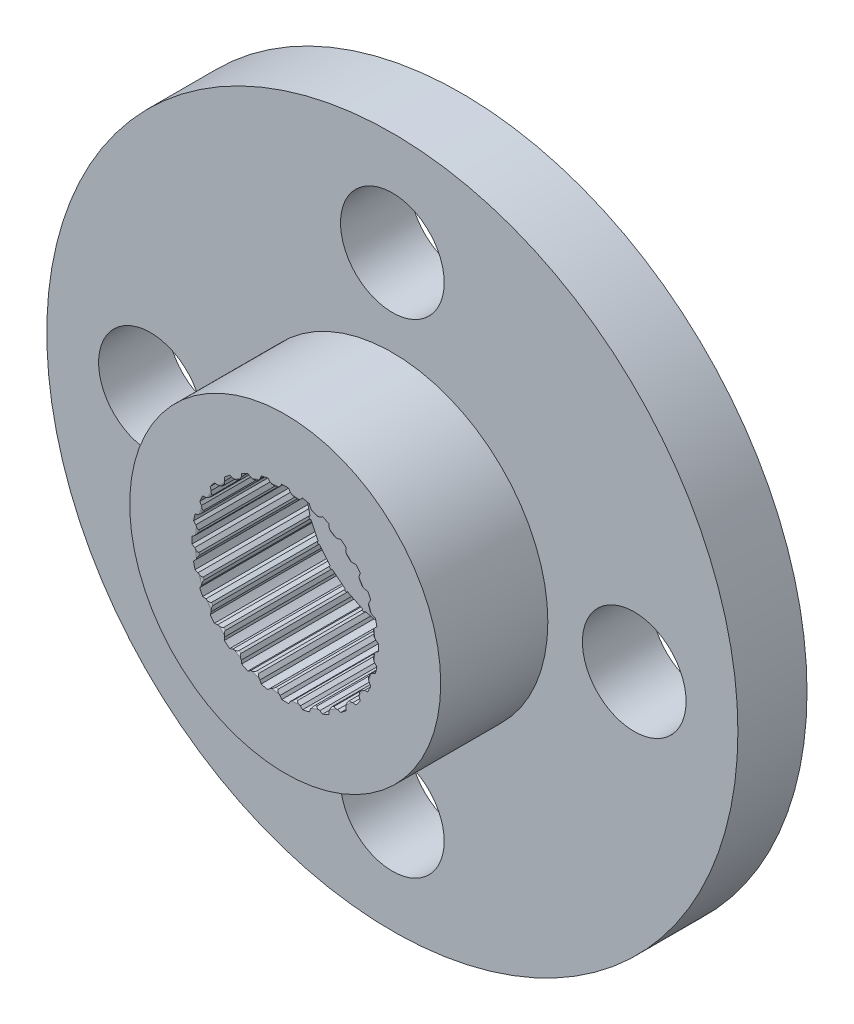
from build123d import *

# Parameters (mm, degrees)
CROQUIS1_R              = 10
CROQUIS1_R_2            = 1.5
SALIENTE_EXTRUIR1_DEPTH = 2
CROQUIS3_R              = 4.5
CROQUIS3_R_2            = 2.55
SALIENTE_EXTRUIR3_DEPTH = 3.1
CORTAR_EXTRUIR2_DEPTH   = 3.4
REDONDEO1_R             = 0.05
MATRIZC1_COUNT          = 28


with BuildPart() as part:
    # Croquis1 → Saliente-Extruir1 (new body)
    with BuildSketch(Plane.XY):
        Circle(CROQUIS1_R)
        with Locations((-7, 0)):
            Circle(CROQUIS1_R_2, mode=Mode.SUBTRACT)
        with Locations((0, 7)):
            Circle(CROQUIS1_R_2, mode=Mode.SUBTRACT)
        with Locations((0, -7)):
            Circle(CROQUIS1_R_2, mode=Mode.SUBTRACT)
        with Locations((7, 0)):
            Circle(CROQUIS1_R_2, mode=Mode.SUBTRACT)
        Circle(CROQUIS1_R_2, mode=Mode.SUBTRACT)
    extrude(amount=SALIENTE_EXTRUIR1_DEPTH)

    # Croquis3 → Saliente-Extruir3 (add)
    with BuildSketch(Plane.XY.offset(2)):
        Circle(CROQUIS3_R)
        Circle(CROQUIS3_R_2, mode=Mode.SUBTRACT)
    extrude(amount=SALIENTE_EXTRUIR3_DEPTH)

    # Croquis4 → Cortar-Extruir2 (cut)
    with BuildSketch(Plane.XY.offset(5.1)):
        with BuildLine():
            Line((-0.246033494, 2.497452058), (0.246033494, 2.497452058))
            Line((0.246033494, 2.497452058), (0.25, 2.537715508))
            Line((0.25, 2.537715508), (0.15, 2.62))
            Line((0.15, 2.62), (0.1, 2.698147513))
            ThreePointArc((0.1, 2.698147513), (0, 2.7), (-0.1, 2.698147513))
            Line((-0.1, 2.698147513), (-0.15, 2.62))
            Line((-0.15, 2.62), (-0.25, 2.537715508))
            Line((-0.25, 2.537715508), (-0.246033494, 2.497452058))
        make_face()
    cortar_extruir2 = extrude(amount=-CORTAR_EXTRUIR2_DEPTH, mode=Mode.SUBTRACT)

    # Redondeo1
    redondeo1_edges = [part.edges().sort_by_distance(p)[0] for p in [
        (0, -2.55, 5.1),
    ]]
    fillet(redondeo1_edges, radius=REDONDEO1_R)

    # MatrizC1: Cortar-Extruir2 ×28 about axis
    matrizc1_axis = Axis((0, 0, 5.1), (0, 0, -1))
    for i in range(1, MATRIZC1_COUNT):
        add(cortar_extruir2.rotate(matrizc1_axis, i * 360 / MATRIZC1_COUNT), mode=Mode.SUBTRACT)


solid = part.part
